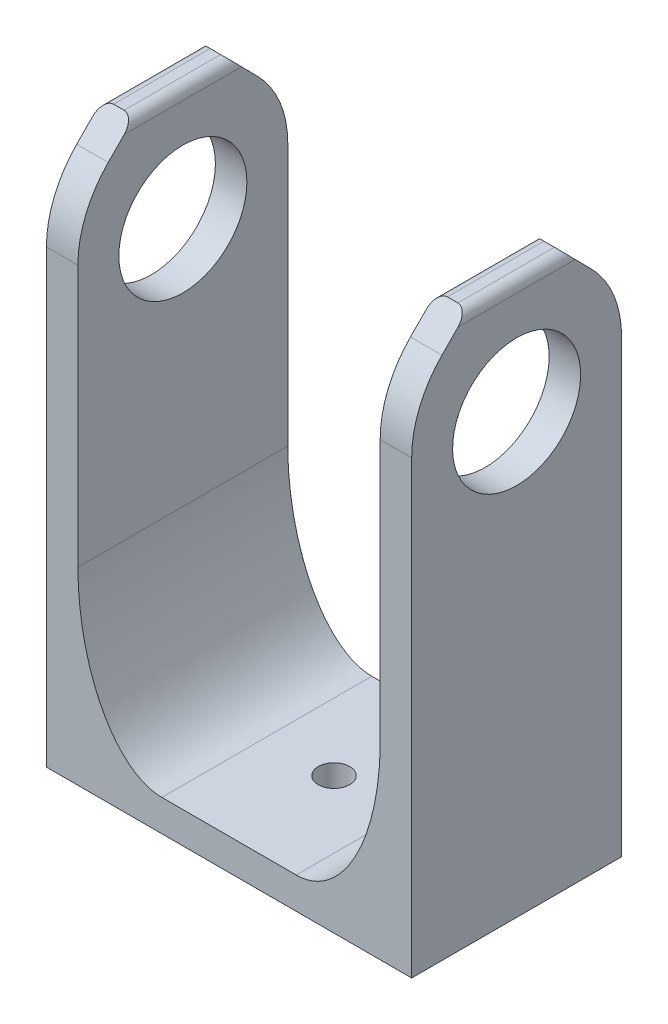
from build123d import *

# Parameters (mm, degrees)
EXTRUDE_1_DEPTH     = 20
CUT_EXTRUDE_1_REACH = 52.828
SKETCH_2_R          = 6.1
SKETCH_3_R          = 1.5
CUT_EXTRUDE_2_DEPTH = 52.5
FILLET_1_R          = 10
FILLET_2_SIZE       = 15
FILLET_2_SIZE_2     = 8
FILLET_3_SIZE       = 8
FILLET_3_SIZE_2     = 15


with BuildPart() as part:
    # 草图1 → 凸台-拉伸1 (new body)
    with BuildSketch(Plane.XY):
        with BuildLine():
            Line((-18.033931645, 1.331428571), (-18.033931645, -31.183456439))
            Line((-18.033931645, -31.183456439), (16.766068355, -31.183456439))
            Line((16.766068355, -31.183456439), (16.766068355, 20.316543561))
            ThreePointArc((16.766068355, 20.316543561), (16.473175136, 21.023650343), (15.766068355, 21.316543561))
            Line((15.766068355, 21.316543561), (14.766068355, 21.316543561))
            ThreePointArc((14.766068355, 21.316543561), (14.058961574, 21.023650343), (13.766068355, 20.316543561))
            Line((13.766068355, 20.316543561), (13.766068355, -23.276677649))
            Line((13.766068355, -23.276677649), (13.766068355, -28.183456439))
            Line((13.766068355, -28.183456439), (9.089631855, -28.183456439))
            Line((9.089631855, -28.183456439), (-9.577824429, -28.183456439))
            Line((-9.577824429, -28.183456439), (-15.033931645, -28.183456439))
            Line((-15.033931645, -28.183456439), (-15.033931645, -23.510349705))
            Line((-15.033931645, -23.510349705), (-15.033931645, -10.276677649))
            Line((-15.033931645, -10.276677649), (-15.033931645, 20.316543561))
            ThreePointArc((-15.033931645, 20.316543561), (-15.326824864, 21.023650343), (-16.033931645, 21.316543561))
            Line((-16.033931645, 21.316543561), (-17.033931645, 21.316543561))
            ThreePointArc((-17.033931645, 21.316543561), (-17.741038426, 21.023650343), (-18.033931645, 20.316543561))
            Line((-18.033931645, 20.316543561), (-18.033931645, 1.331428571))
        make_face()
    extrude(amount=EXTRUDE_1_DEPTH)

    # 切除-拉伸1: up to this face of the body (flat: up to its plane)
    cut_extrude_1_end = Plane(part.part.faces().sort_by_distance((-18.033931645, -5.433456439, 10))[0])
    # 草图2 → 切除-拉伸1 (cut, up to the picked face)
    with BuildSketch(Plane(origin=(16.766068355, 0, 0), x_dir=(0, 0, -1), z_dir=(1, 0, 0)), mode=Mode.PRIVATE) as cut_extrude_1_sk1:
        with Locations((-10, 10.543673469)):
            Circle(SKETCH_2_R)
    cut_extrude_1_tool1 = split(extrude(cut_extrude_1_sk1.sketch, amount=-CUT_EXTRUDE_1_REACH, mode=Mode.PRIVATE), bisect_by=cut_extrude_1_end, keep=Keep.BOTH, mode=Mode.PRIVATE)
    # 草图2 → 切除-拉伸1 (cut, up to the picked face)
    with BuildSketch(Plane(origin=(16.766068355, 0, 0), x_dir=(0, 0, -1), z_dir=(1, 0, 0)), mode=Mode.PRIVATE) as cut_extrude_1_sk2:
        Polygon((0, 15.84743417), (-5.402663646, 21.316543561), (0, 21.316543561), align=None)
    cut_extrude_1_tool2 = split(extrude(cut_extrude_1_sk2.sketch, amount=-CUT_EXTRUDE_1_REACH, mode=Mode.PRIVATE), bisect_by=cut_extrude_1_end, keep=Keep.BOTH, mode=Mode.PRIVATE)
    # 草图2 → 切除-拉伸1 (cut, up to the picked face)
    with BuildSketch(Plane(origin=(16.766068355, 0, 0), x_dir=(0, 0, -1), z_dir=(1, 0, 0)), mode=Mode.PRIVATE) as cut_extrude_1_sk3:
        Polygon((-20, 15.84743417), (-14.597336354, 21.316543561), (-20, 21.316543561), align=None)
    cut_extrude_1_tool3 = split(extrude(cut_extrude_1_sk3.sketch, amount=-CUT_EXTRUDE_1_REACH, mode=Mode.PRIVATE), bisect_by=cut_extrude_1_end, keep=Keep.BOTH, mode=Mode.PRIVATE)
    add(cut_extrude_1_tool1.solids().sort_by(Axis((16.766068, 10.543673, 10), (-1, 0, 0)))[0], mode=Mode.SUBTRACT)
    add(cut_extrude_1_tool2.solids().sort_by(Axis((16.766068, 19.493507, 1.800888), (-1, 0, 0)))[0], mode=Mode.SUBTRACT)
    add(cut_extrude_1_tool3.solids().sort_by(Axis((16.766068, 19.493507, 18.199112), (-1, 0, 0)))[0], mode=Mode.SUBTRACT)

    # 草图3 → 切除-拉伸2 (cut)
    with BuildSketch(Plane.XZ.offset(31.183456439)):
        with Locations((-0.633931645, 10)):
            Circle(SKETCH_3_R)
    extrude(amount=-CUT_EXTRUDE_2_DEPTH, mode=Mode.SUBTRACT)

    # 圆角1
    fillet_1_edges = [part.edges().sort_by_distance(p)[0] for p in [
        (15.266068355, 15.84743417, 0),
        (15.266068355, 15.84743417, 20),
        (-16.533931645, 15.84743417, 20),
        (-16.533931645, 15.84743417, 0),
    ]]
    fillet(fillet_1_edges, radius=FILLET_1_R)

    # 圆角2
    # an asymmetric fillet: 15, 8 mm, written as the material it adds along each edge
    with BuildSketch(Plane(origin=(-15.033931645, -28.183456439, 0), x_dir=(0, 1, 0), z_dir=(0, 0, 1))) as fillet_2_piece_1:
        with BuildLine():
            Bezier((FILLET_2_SIZE, 0), (0, 0), (0, -FILLET_2_SIZE_2), weights=[1, 0.707106781, 1])
            Line((0, -FILLET_2_SIZE_2), (0, 0))
            Line((0, 0), (FILLET_2_SIZE, 0))
        make_face()
    extrude(amount=20)

    # 圆角3
    # an asymmetric fillet: 15, 8 mm, written as the material it adds along each edge
    with BuildSketch(Plane(origin=(13.766068355, -28.183456439, 0), x_dir=(-1, 0, 0), z_dir=(0, 0, 1))) as fillet_3_piece_1:
        with BuildLine():
            Bezier((FILLET_3_SIZE, 0), (0, 0), (0, -FILLET_3_SIZE_2), weights=[1, 0.707106781, 1])
            Line((0, -FILLET_3_SIZE_2), (0, 0))
            Line((0, 0), (FILLET_3_SIZE, 0))
        make_face()
    extrude(amount=20)


solid = part.part
